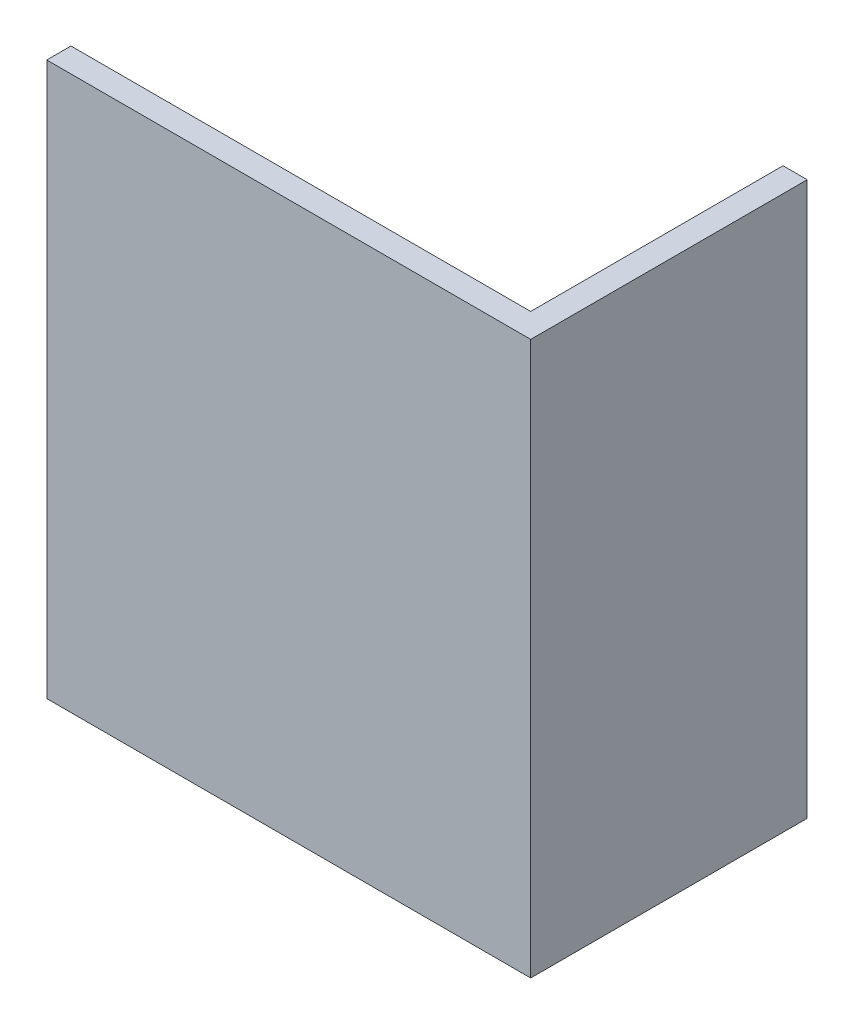
from build123d import *

# Parameters (mm, degrees)
BOSS_EXTRUDE1_DEPTH = 40


with BuildPart() as part:
    # Sketch1 → Boss-Extrude1 (new body)
    with BuildSketch(Plane(origin=(0, 0, 0), x_dir=(1, 0, 0), z_dir=(0, 1, 0))):
        Polygon((-35, 0), (-35, -1.75), (0, -1.75), (0, 18.25), (-1.75, 18.25), (-1.75, 0), align=None)
    extrude(amount=BOSS_EXTRUDE1_DEPTH)


solid = part.part
